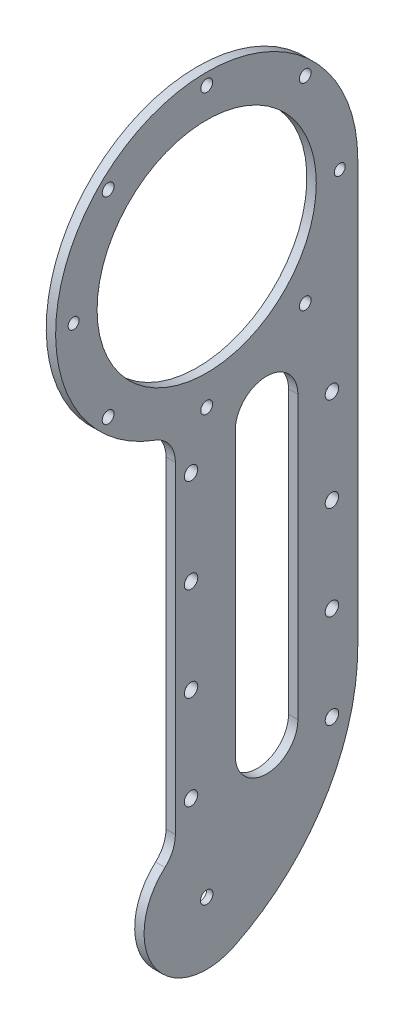
from build123d import *

# Parameters (mm, degrees)
EXTRUDE_3_DEPTH        = 3
SKETCH_5_R             = 1.9
SKETCH_5_R_2           = 1.75
CUT_EXTRUDE_3_DEPTH    = 201.903117198
SKETCH_6_R             = 2
CUT_EXTRUDE_4_DEPTH    = 10
SKETCH_7_OUTSIDE_W     = 150.842
SKETCH_7_OUTSIDE_H     = 297.592
SKETCH_7_OUTSIDE_R     = 1.9
SKETCH_7_OUTSIDE_R_2   = 1.75
SKETCH_7_OUTSIDE_R_3   = 2
CUT_EXTRUDE_5_DEPTH    = 10
SKETCH_7_3_R           = 2
EXTRUDE_6_DEPTH        = 3
FILLET_1_R             = 10
SKETCH_9_R             = 2.15
CUT_EXTRUDE_6_DEPTH    = 3
PATTERN_LINEAR_1_COUNT = 4
PATTERN_LINEAR_1_PITCH = 30
SKETCH_10_R            = 5
CUT_EXTRUDE_7_DEPTH    = 1
SKETCH_11_R            = 35
CUT_EXTRUDE_8_DEPTH    = 7
CUT_EXTRUDE_9_DEPTH    = 7


with BuildPart() as part:
    # 草图1 → 凸台-拉伸3 (new body)
    with BuildSketch(Plane(origin=(0, 0, 0), x_dir=(0, 0, -1), z_dir=(1, 0, 0))):
        with BuildLine():
            Line((14.741861573, -182.770833333), (47.419654727, -8.912847222))
            ThreePointArc((47.419654727, -8.912847222), (0, 48.25), (-47.419654727, -8.912847222))
            Line((-47.419654727, -8.912847222), (-14.741861573, -182.770833333))
            ThreePointArc((-14.741861573, -182.770833333), (0, -195), (14.741861573, -182.770833333))
        make_face()
    extrude(amount=EXTRUDE_3_DEPTH)

    # 草图5 → 切除-拉伸3 (cut, through all)
    with BuildSketch(Plane(origin=(0, 0, 0), x_dir=(0, 0, -1), z_dir=(1, 0, 0))):
        with Locations((0, 44.5)):
            Circle(SKETCH_5_R)
        with Locations((31.466251763, 31.466251763)):
            Circle(SKETCH_5_R)
        with Locations((31.466251763, -31.466251763)):
            Circle(SKETCH_5_R)
        with Locations((0, -44.5)):
            Circle(SKETCH_5_R)
        with Locations((-31.466251763, -31.466251763)):
            Circle(SKETCH_5_R)
        with Locations((-31.466251763, 31.466251763)):
            Circle(SKETCH_5_R)
        with Locations((-42.5, 0)):
            Circle(SKETCH_5_R_2)
        with Locations((42.5, 0)):
            Circle(SKETCH_5_R_2)
    extrude(amount=CUT_EXTRUDE_3_DEPTH, mode=Mode.SUBTRACT)

    # 草图6 → 切除-拉伸4 (cut)
    with BuildSketch(Plane(origin=(3, 0, 0), x_dir=(0, 0, -1), z_dir=(1, 0, 0))):
        with Locations((0, -180)):
            Circle(SKETCH_6_R)
    extrude(amount=-CUT_EXTRUDE_4_DEPTH, mode=Mode.SUBTRACT)

    # 草图7 outside → 切除-拉伸5 (cut)
    # profile 1 of 10: a face of its own
    with BuildSketch(Plane(origin=(3, 0, 0), x_dir=(0, 0, -1), z_dir=(1, 0, 0))):
        with Locations((0, -73.375)):
            Rectangle(SKETCH_7_OUTSIDE_W, SKETCH_7_OUTSIDE_H)
        with BuildLine():
            ThreePointArc((47.419654727, -8.912847222), (-26.768998458, 40.143283642), (-10, -47.202356933))
            Line((-10, -47.202356933), (-10, -162.679491924))
            ThreePointArc((-10, -162.679491924), (-5.047351641, -199.352628799), (17.185506881, -169.769733472))
            Line((17.185506881, -169.769733472), (47.419654727, -8.912847222))
        make_face(mode=Mode.SUBTRACT)
    # profile 2 of 10: a face of its own
    with BuildSketch(Plane(origin=(3, 0, 0), x_dir=(0, 0, -1), z_dir=(1, 0, 0))):
        with Locations((-31.466251763, -31.466251763)):
            Circle(SKETCH_7_OUTSIDE_R)
    # profile 3 of 10: a face of its own
    with BuildSketch(Plane(origin=(3, 0, 0), x_dir=(0, 0, -1), z_dir=(1, 0, 0))):
        with Locations((-42.5, 0)):
            Circle(SKETCH_7_OUTSIDE_R_2)
    # profile 4 of 10: a face of its own
    with BuildSketch(Plane(origin=(3, 0, 0), x_dir=(0, 0, -1), z_dir=(1, 0, 0))):
        with Locations((-31.466251763, 31.466251763)):
            Circle(SKETCH_7_OUTSIDE_R)
    # profile 5 of 10: a face of its own
    with BuildSketch(Plane(origin=(3, 0, 0), x_dir=(0, 0, -1), z_dir=(1, 0, 0))):
        with Locations((0, -44.5)):
            Circle(SKETCH_7_OUTSIDE_R)
    # profile 6 of 10: a face of its own
    with BuildSketch(Plane(origin=(3, 0, 0), x_dir=(0, 0, -1), z_dir=(1, 0, 0))):
        with Locations((31.466251763, -31.466251763)):
            Circle(SKETCH_7_OUTSIDE_R)
    # profile 7 of 10: a face of its own
    with BuildSketch(Plane(origin=(3, 0, 0), x_dir=(0, 0, -1), z_dir=(1, 0, 0))):
        with Locations((0, 44.5)):
            Circle(SKETCH_7_OUTSIDE_R)
    # profile 8 of 10: a face of its own
    with BuildSketch(Plane(origin=(3, 0, 0), x_dir=(0, 0, -1), z_dir=(1, 0, 0))):
        with Locations((42.5, 0)):
            Circle(SKETCH_7_OUTSIDE_R_2)
    # profile 9 of 10: a face of its own
    with BuildSketch(Plane(origin=(3, 0, 0), x_dir=(0, 0, -1), z_dir=(1, 0, 0))):
        with Locations((31.466251763, 31.466251763)):
            Circle(SKETCH_7_OUTSIDE_R)
    # profile 10 of 10: a face of its own
    with BuildSketch(Plane(origin=(3, 0, 0), x_dir=(0, 0, -1), z_dir=(1, 0, 0))):
        with Locations((0, -180)):
            Circle(SKETCH_7_OUTSIDE_R_3)
    extrude(amount=-CUT_EXTRUDE_5_DEPTH, mode=Mode.SUBTRACT)

    # 草图7<3> → 凸台-拉伸6 (add)
    with BuildSketch(Plane(origin=(3, 0, 0), x_dir=(0, 0, -1), z_dir=(1, 0, 0))):
        with BuildLine():
            Line((48.25, -134.848327692), (48.25, 0))
            ThreePointArc((48.25, 0), (48.0419652, -4.47572114), (47.419654727, -8.912847222))
            Line((47.419654727, -8.912847222), (17.185506881, -169.769733472))
            ThreePointArc((17.185506881, -169.769733472), (-19.161398477, -174.269309953), (8.746749834, -197.985949164))
            ThreePointArc((8.746749834, -197.985949164), (37.560406478, -172.086970319), (48.25, -134.848327692))
        make_face()
        with Locations((0, -180)):
            Circle(SKETCH_7_3_R, mode=Mode.SUBTRACT)
    extrude(amount=-EXTRUDE_6_DEPTH)

    # 圆角1
    fillet_1_edges = [part.edges().sort_by_distance(p)[0] for p in [
        (1.5, -162.679491924, 10),
        (1.5, -47.202356933, 10),
    ]]
    fillet(fillet_1_edges, radius=FILLET_1_R)

    # 草图9 → 切除-拉伸6 (cut)
    with BuildSketch(Plane(origin=(3, 0, 0), x_dir=(0, 0, -1), z_dir=(1, 0, 0))):
        with Locations((40, -60.145481746)):
            Circle(SKETCH_9_R)
        with Locations((-5, -60.145481746)):
            Circle(SKETCH_9_R)
    cut_extrude_6 = extrude(amount=-CUT_EXTRUDE_6_DEPTH, mode=Mode.SUBTRACT)

    # 阵列(线性)1: 切除-拉伸6 ×4
    with Locations(*[(0, -i * PATTERN_LINEAR_1_PITCH, 0) for i in range(1, PATTERN_LINEAR_1_COUNT)]):
        add(cut_extrude_6, mode=Mode.SUBTRACT)

    # 草图10 → 切除-拉伸7 (cut)
    with BuildSketch(Plane.ZY):
        with Locations((0, -180)):
            Circle(SKETCH_10_R)
    extrude(amount=-CUT_EXTRUDE_7_DEPTH, mode=Mode.SUBTRACT)

    # 草图11 → 切除-拉伸8 (cut)
    with BuildSketch(Plane.ZY):
        Circle(SKETCH_11_R)
    extrude(amount=-CUT_EXTRUDE_8_DEPTH, mode=Mode.SUBTRACT)

    # 草图12 → 切除-拉伸9 (cut)
    with BuildSketch(Plane.ZY):
        with BuildLine():
            Line((-29.125, -145.453012475), (-29.125, -55.453012475))
            ThreePointArc((-29.125, -55.453012475), (-19.125, -45.453012475), (-9.125, -55.453012475))
            Line((-9.125, -55.453012475), (-9.125, -145.453012475))
            ThreePointArc((-9.125, -145.453012475), (-19.125, -155.453012475), (-29.125, -145.453012475))
        make_face()
    extrude(amount=-CUT_EXTRUDE_9_DEPTH, mode=Mode.SUBTRACT)


solid = part.part
